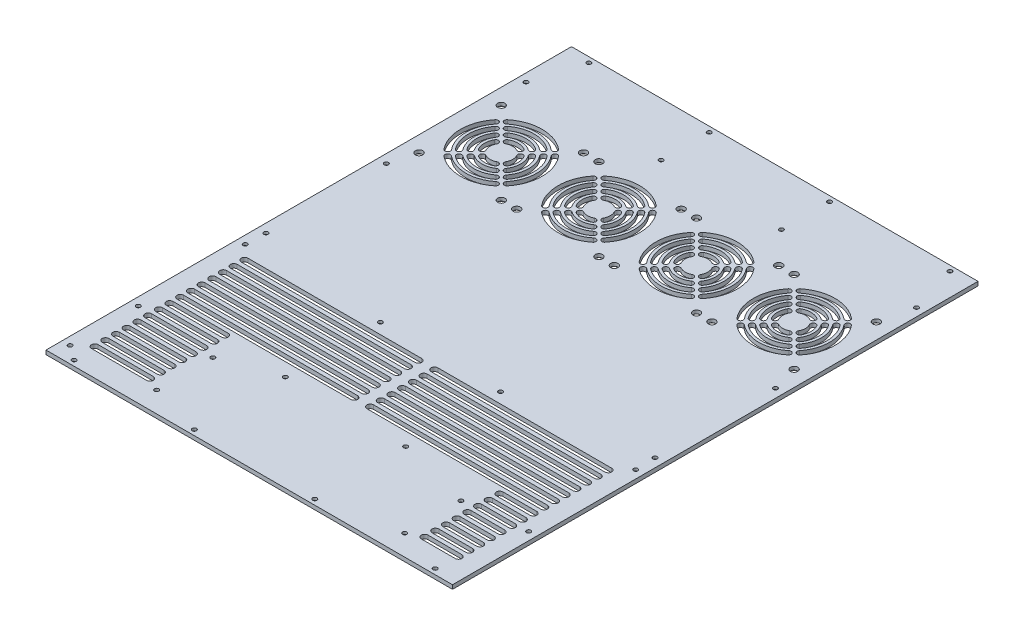
from build123d import *

# Parameters (mm, degrees)
SKIZZE1_W                       = 304
SKIZZE1_H                       = 393
AUFSATZ_LINEAR_AUSTRAGEN1_DEPTH = 3
SKIZZE3_R                       = 1.6
PCB_SCREWS_DEPTH                = 293.596992466
SKIZZE8_R                       = 1.6
MAIN_SCREWS_DEPTH               = 293.596992466
SKIZZE12_R                      = 1.6
SCHNITT_LINEAR_AUSTRAGEN5_DEPTH = 293.596992466
SCHNITT_LINEAR_AUSTRAGEN4_DEPTH = 293.596992466
SKIZZE9_R                       = 2.75
SCHNITT_LINEAR_AUSTRAGEN2_DEPTH = 10
FASE2_SIZE                      = 0.5
KREISMUSTER1_COUNT              = 4
FASE2_OF_KREISMUSTER1_SIZE      = 0.5
LINEARES_MUSTER1_DEPTH          = 3
SCHNITT_LINEAR_AUSTRAGEN3_DEPTH = 293.596992466
FASE1_SIZE                      = 1


# Read off the part's stored shape, not the designer's step: Lineares Muster1
with BuildPart() as part:
    # Skizze1 → Aufsatz-Linear austragen1 (new body)
    with BuildSketch(Plane(origin=(0, 0, 0), x_dir=(1, 0, 0), z_dir=(0, 1, 0))):
        with Locations((0, 53.5)):
            Rectangle(SKIZZE1_W, SKIZZE1_H)
    extrude(amount=AUFSATZ_LINEAR_AUSTRAGEN1_DEPTH)

    # Skizze3 → PCB-Screws (cut, through all)
    with BuildSketch(Plane(origin=(0, 3, 0), x_dir=(1, 0, 0), z_dir=(0, 1, 0))):
        with Locations(Location((-146, -131, 0), (0, 0, 270))):
            Circle(SKIZZE3_R)
        with Locations(Location((-146, -80, 0), (0, 0, 270))):
            Circle(SKIZZE3_R)
        with Locations(Location((-146, 0, 0), (0, 0, 270))):
            Circle(SKIZZE3_R)
        with Locations(Location((-45, 0, 0), (0, 0, 270))):
            Circle(SKIZZE3_R)
        with Locations(Location((45, 0, 0), (0, 0, 270))):
            Circle(SKIZZE3_R)
        with Locations(Location((146, 0, 0), (0, 0, 270))):
            Circle(SKIZZE3_R)
        with Locations(Location((146, -80, 0), (0, 0, 270))):
            Circle(SKIZZE3_R)
        with Locations(Location((146, 210, 0), (0, 0, 270))):
            Circle(SKIZZE3_R)
        with Locations(Location((45, 210, 0), (0, 0, 270))):
            Circle(SKIZZE3_R)
        with Locations(Location((-45, 210, 0), (0, 0, 270))):
            Circle(SKIZZE3_R)
        with Locations(Location((-146, 210, 0), (0, 0, 270))):
            Circle(SKIZZE3_R)
        with Locations(Location((-45, -71, 0), (0, 0, 270))):
            Circle(SKIZZE3_R)
        with Locations(Location((45, -71, 0), (0, 0, 270))):
            Circle(SKIZZE3_R)
    extrude(amount=-PCB_SCREWS_DEPTH, mode=Mode.SUBTRACT)

    # Skizze8 → Main-Screws (cut, through all)
    with BuildSketch(Plane(origin=(0, 3, 0), x_dir=(1, 0, 0), z_dir=(0, 1, 0))):
        with Locations(Location((-135, 246, 0), (0, 0, 270))):
            Circle(SKIZZE8_R)
        with Locations(Location((-45, 246, 0), (0, 0, 270))):
            Circle(SKIZZE8_R)
        with Locations(Location((45, 246, 0), (0, 0, 270))):
            Circle(SKIZZE8_R)
        with Locations(Location((135, 246, 0), (0, 0, 270))):
            Circle(SKIZZE8_R)
        with Locations(Location((-135, -139, 0), (0, 0, 270))):
            Circle(SKIZZE8_R)
        with Locations(Location((-45, -139, 0), (0, 0, 270))):
            Circle(SKIZZE8_R)
        with Locations(Location((45, -139, 0), (0, 0, 270))):
            Circle(SKIZZE8_R)
        with Locations(Location((135, -139, 0), (0, 0, 270))):
            Circle(SKIZZE8_R)
    extrude(amount=-MAIN_SCREWS_DEPTH, mode=Mode.SUBTRACT)

    # Skizze12 → Schnitt-Linear austragen5 (cut, through all)
    with BuildSketch(Plane(origin=(0, 3, 0), x_dir=(1, 0, 0), z_dir=(0, 1, 0))):
        with Locations(Location((-145.5, 15, 0), (0, 0, 270))):
            Circle(SKIZZE12_R)
        with Locations(Location((145.5, 105, 0), (0, 0, 270))):
            Circle(SKIZZE12_R)
        with Locations(Location((-145.5, 105, 0), (0, 0, 90))):
            Circle(SKIZZE12_R)
        with Locations(Location((145.5, 15, 0), (0, 0, 270))):
            Circle(SKIZZE12_R)
    extrude(amount=-SCHNITT_LINEAR_AUSTRAGEN5_DEPTH, mode=Mode.SUBTRACT)

    # Skizze11 → Schnitt-Linear austragen4 (cut, through all)
    with BuildSketch(Plane(origin=(0, 3, 0), x_dir=(1, 0, 0), z_dir=(0, 1, 0))):
        with BuildLine():
            ThreePointArc((-83.15, -127.5), (-83.61862915, -126.36862915), (-84.75, -125.9))
            Line((-84.75, -125.9), (-84.75, -127.5))
            Line((-84.75, -127.5), (-83.15, -127.5))
        make_face()
        with BuildLine():
            Line((-84.75, -127.5), (-84.75, -125.9))
            ThreePointArc((-84.75, -125.9), (-85.88137085, -128.63137085), (-83.15, -127.5))
            Line((-83.15, -127.5), (-84.75, -127.5))
        make_face()
        with BuildLine():
            Line((-84.75, -87.1), (-84.75, -85.5))
            Line((-84.75, -85.5), (-83.15, -85.5))
            ThreePointArc((-83.15, -85.5), (-85.88137085, -84.36862915), (-84.75, -87.1))
        make_face()
        with BuildLine():
            Line((-83.15, -85.5), (-84.75, -85.5))
            Line((-84.75, -85.5), (-84.75, -87.1))
            ThreePointArc((-84.75, -87.1), (-83.61862915, -86.63137085), (-83.15, -85.5))
        make_face()
        with BuildLine():
            ThreePointArc((102.35, -127.5), (101.88137085, -126.36862915), (100.75, -125.9))
            Line((100.75, -125.9), (100.75, -127.5))
            Line((100.75, -127.5), (99.15, -127.5))
            ThreePointArc((99.15, -127.5), (100.75, -129.1), (102.35, -127.5))
        make_face()
        with BuildLine():
            Line((100.75, -127.5), (100.75, -125.9))
            ThreePointArc((100.75, -125.9), (99.61862915, -126.36862915), (99.15, -127.5))
            Line((99.15, -127.5), (100.75, -127.5))
        make_face()
        with BuildLine():
            ThreePointArc((102.35, -85.5), (100.75, -83.9), (99.15, -85.5))
            Line((99.15, -85.5), (100.75, -85.5))
            Line((100.75, -85.5), (100.75, -87.1))
            ThreePointArc((100.75, -87.1), (101.88137085, -86.63137085), (102.35, -85.5))
        make_face()
        with BuildLine():
            Line((100.75, -85.5), (99.15, -85.5))
            ThreePointArc((99.15, -85.5), (99.61862915, -86.63137085), (100.75, -87.1))
            Line((100.75, -87.1), (100.75, -85.5))
        make_face()
    extrude(amount=-SCHNITT_LINEAR_AUSTRAGEN4_DEPTH, mode=Mode.SUBTRACT)

    # Skizze9 → Schnitt-Linear austragen2 (cut)
    with BuildSketch(Plane(origin=(0, 3, 0), x_dir=(1, 0, 0), z_dir=(0, 1, 0))):
        with BuildLine():
            ThreePointArc((-130.106682822, 171.661771306), (-130.404411993, 174.474484825), (-133.217125512, 174.176755654))
            ThreePointArc((-133.217125512, 174.176755654), (-140, 155), (-133.217125512, 135.823244346))
            ThreePointArc((-133.217125512, 135.823244346), (-130.404411993, 135.525515175), (-130.106682822, 138.338228694))
            ThreePointArc((-130.106682822, 138.338228694), (-136, 155), (-130.106682822, 171.661771306))
        make_face()
        with BuildLine():
            ThreePointArc((-125.798917155, 167.433424277), (-126.176064964, 170.236776907), (-128.979417594, 169.859629098))
            ThreePointArc((-128.979417594, 169.859629098), (-134.000128301, 155), (-128.979417594, 140.140370902))
            ThreePointArc((-128.979417594, 140.140370902), (-126.176064964, 139.763223093), (-125.798917155, 142.566575723))
            ThreePointArc((-125.798917155, 142.566575723), (-129.999871699, 155), (-125.798917155, 167.433424277))
        make_face()
        with BuildLine():
            ThreePointArc((-121.446342825, 163.217961615), (-121.960602302, 165.999244986), (-124.741885673, 165.484985509))
            ThreePointArc((-124.741885673, 165.484985509), (-128, 155), (-124.741885673, 144.515014491))
            ThreePointArc((-124.741885673, 144.515014491), (-121.960602302, 144.000755014), (-121.446342825, 146.782038385))
            ThreePointArc((-121.446342825, 146.782038385), (-124, 155), (-121.446342825, 163.217961615))
        make_face()
        with BuildLine():
            ThreePointArc((-116.977122207, 159.042603555), (-117.785244242, 161.753127264), (-120.495767951, 160.945005228))
            ThreePointArc((-120.495767951, 160.945005228), (-122, 155), (-120.495767951, 149.054994772))
            ThreePointArc((-120.495767951, 149.054994772), (-117.785244242, 148.246872736), (-116.977122207, 150.957396445))
            ThreePointArc((-116.977122207, 150.957396445), (-118, 155), (-116.977122207, 159.042603555))
        make_face()
        with Locations(Location((-140.25, 185.75, 0), (0, 0, 270))):
            Circle(SKIZZE9_R)
    schnitt_linear_austragen2 = extrude(amount=-SCHNITT_LINEAR_AUSTRAGEN2_DEPTH, mode=Mode.SUBTRACT)

    # Fase2
    fase2_edges = [part.edges().sort_by_distance(p)[0] for p in [
        (-140.25, 0, -188.5),
    ]]
    chamfer(fase2_edges, length=FASE2_SIZE)

    # Kreismuster1: Schnitt-Linear austragen2 ×4 about axis
    kreismuster1_axis = Axis((-109.5, 0, -155), (0, 1, 0))
    for i in range(1, KREISMUSTER1_COUNT):
        add(schnitt_linear_austragen2.rotate(kreismuster1_axis, i * 360 / KREISMUSTER1_COUNT), mode=Mode.SUBTRACT)

    # Fase2 of Kreismuster1
    fase2_of_kreismuster1_edges = [part.edges().sort_by_distance(p)[0] for p in [
        (-143, 0, -124.25),
        (-78.75, 0, -121.5),
        (-76, 0, -185.75),
    ]]
    chamfer(fase2_of_kreismuster1_edges, length=FASE2_OF_KREISMUSTER1_SIZE)

    # Lineares Muster1 outline → Lineares Muster1 (cut)
    with BuildSketch(Plane(origin=(0, 0, 0), x_dir=(1, 0, 0), z_dir=(0, 1, 0))):
        with BuildLine():
            ThreePointArc((-24.066575723, 171.298917155), (-21.263223093, 171.676064964), (-21.640370902, 174.479417594))
            ThreePointArc((-21.640370902, 174.479417594), (-36.5, 179.500128301), (-51.359629098, 174.479417594))
            ThreePointArc((-51.359629098, 174.479417594), (-51.736776907, 171.676064964), (-48.933424277, 171.298917155))
            ThreePointArc((-48.933424277, 171.298917155), (-36.5, 175.499871699), (-24.066575723, 171.298917155))
        make_face()
        with BuildLine():
            ThreePointArc((-48.933424277, 138.701082845), (-51.736776907, 138.323935036), (-51.359629098, 135.520582406))
            ThreePointArc((-51.359629098, 135.520582406), (-36.5, 130.499871699), (-21.640370902, 135.520582406))
            ThreePointArc((-21.640370902, 135.520582406), (-21.263223093, 138.323935036), (-24.066575723, 138.701082845))
            ThreePointArc((-24.066575723, 138.701082845), (-36.5, 134.500128301), (-48.933424277, 138.701082845))
        make_face()
        with BuildLine():
            ThreePointArc((-52.798917155, 167.433424277), (-53.176064964, 170.236776907), (-55.979417594, 169.859629098))
            ThreePointArc((-55.979417594, 169.859629098), (-61.000128301, 155), (-55.979417594, 140.140370902))
            ThreePointArc((-55.979417594, 140.140370902), (-53.176064964, 139.763223093), (-52.798917155, 142.566575723))
            ThreePointArc((-52.798917155, 142.566575723), (-56.999871699, 155), (-52.798917155, 167.433424277))
        make_face()
        with BuildLine():
            ThreePointArc((-20.201082845, 142.566575723), (-19.823935036, 139.763223093), (-17.020582406, 140.140370902))
            ThreePointArc((-17.020582406, 140.140370902), (-11.999871699, 155), (-17.020582406, 169.859629098))
            ThreePointArc((-17.020582406, 169.859629098), (-19.823935036, 170.236776907), (-20.201082845, 167.433424277))
            ThreePointArc((-20.201082845, 167.433424277), (-16.000128301, 155), (-20.201082845, 142.566575723))
        make_face()
        with BuildLine():
            ThreePointArc((-28.282038385, 166.946342825), (-25.500755014, 167.460602302), (-26.015014491, 170.241885673))
            ThreePointArc((-26.015014491, 170.241885673), (-36.5, 173.5), (-46.984985509, 170.241885673))
            ThreePointArc((-46.984985509, 170.241885673), (-47.499244986, 167.460602302), (-44.717961615, 166.946342825))
            ThreePointArc((-44.717961615, 166.946342825), (-36.5, 169.5), (-28.282038385, 166.946342825))
        make_face()
        with BuildLine():
            ThreePointArc((-44.717961615, 143.053657175), (-47.499244986, 142.539397698), (-46.984985509, 139.758114327))
            ThreePointArc((-46.984985509, 139.758114327), (-36.5, 136.5), (-26.015014491, 139.758114327))
            ThreePointArc((-26.015014491, 139.758114327), (-25.500755014, 142.539397698), (-28.282038385, 143.053657175))
            ThreePointArc((-28.282038385, 143.053657175), (-36.5, 140.5), (-44.717961615, 143.053657175))
        make_face()
        with BuildLine():
            ThreePointArc((-48.446342825, 163.217961615), (-48.960602302, 165.999244986), (-51.741885673, 165.484985509))
            ThreePointArc((-51.741885673, 165.484985509), (-55, 155), (-51.741885673, 144.515014491))
            ThreePointArc((-51.741885673, 144.515014491), (-48.960602302, 144.000755014), (-48.446342825, 146.782038385))
            ThreePointArc((-48.446342825, 146.782038385), (-51, 155), (-48.446342825, 163.217961615))
        make_face()
        with BuildLine():
            ThreePointArc((-24.553657175, 146.782038385), (-24.039397698, 144.000755014), (-21.258114327, 144.515014491))
            ThreePointArc((-21.258114327, 144.515014491), (-18, 155), (-21.258114327, 165.484985509))
            ThreePointArc((-21.258114327, 165.484985509), (-24.039397698, 165.999244986), (-24.553657175, 163.217961615))
            ThreePointArc((-24.553657175, 163.217961615), (-22, 155), (-24.553657175, 146.782038385))
        make_face()
        with BuildLine():
            ThreePointArc((-19.838228694, 175.606682822), (-17.025515175, 175.904411993), (-17.323244346, 178.717125512))
            ThreePointArc((-17.323244346, 178.717125512), (-36.5, 185.5), (-55.676755654, 178.717125512))
            ThreePointArc((-55.676755654, 178.717125512), (-55.974484825, 175.904411993), (-53.161771306, 175.606682822))
            ThreePointArc((-53.161771306, 175.606682822), (-36.5, 181.5), (-19.838228694, 175.606682822))
        make_face()
        with BuildLine():
            ThreePointArc((-57.106682822, 171.661771306), (-57.404411993, 174.474484825), (-60.217125512, 174.176755654))
            ThreePointArc((-60.217125512, 174.176755654), (-67, 155), (-60.217125512, 135.823244346))
            ThreePointArc((-60.217125512, 135.823244346), (-57.404411993, 135.525515175), (-57.106682822, 138.338228694))
            ThreePointArc((-57.106682822, 138.338228694), (-63, 155), (-57.106682822, 171.661771306))
        make_face()
        with BuildLine():
            ThreePointArc((-15.893317178, 138.338228694), (-15.595588007, 135.525515175), (-12.782874488, 135.823244346))
            ThreePointArc((-12.782874488, 135.823244346), (-6, 155), (-12.782874488, 174.176755654))
            ThreePointArc((-12.782874488, 174.176755654), (-15.595588007, 174.474484825), (-15.893317178, 171.661771306))
            ThreePointArc((-15.893317178, 171.661771306), (-10, 155), (-15.893317178, 138.338228694))
        make_face()
        with BuildLine():
            ThreePointArc((-53.161771306, 134.393317178), (-55.974484825, 134.095588007), (-55.676755654, 131.282874488))
            ThreePointArc((-55.676755654, 131.282874488), (-36.5, 124.5), (-17.323244346, 131.282874488))
            ThreePointArc((-17.323244346, 131.282874488), (-17.025515175, 134.095588007), (-19.838228694, 134.393317178))
            ThreePointArc((-19.838228694, 134.393317178), (-36.5, 128.5), (-53.161771306, 134.393317178))
        make_face()
        with BuildLine():
            ThreePointArc((-40.542603555, 147.522877793), (-43.253127264, 146.714755758), (-42.445005228, 144.004232049))
            ThreePointArc((-42.445005228, 144.004232049), (-36.5, 142.5), (-30.554994772, 144.004232049))
            ThreePointArc((-30.554994772, 144.004232049), (-29.746872736, 146.714755758), (-32.457396445, 147.522877793))
            ThreePointArc((-32.457396445, 147.522877793), (-36.5, 146.5), (-40.542603555, 147.522877793))
        make_face()
        with BuildLine():
            ThreePointArc((-43.977122207, 159.042603555), (-44.785244242, 161.753127264), (-47.495767951, 160.945005228))
            ThreePointArc((-47.495767951, 160.945005228), (-49, 155), (-47.495767951, 149.054994772))
            ThreePointArc((-47.495767951, 149.054994772), (-44.785244242, 148.246872736), (-43.977122207, 150.957396445))
            ThreePointArc((-43.977122207, 150.957396445), (-45, 155), (-43.977122207, 159.042603555))
        make_face()
        with BuildLine():
            ThreePointArc((-32.457396445, 162.477122207), (-29.746872736, 163.285244242), (-30.554994772, 165.995767951))
            ThreePointArc((-30.554994772, 165.995767951), (-36.5, 167.5), (-42.445005228, 165.995767951))
            ThreePointArc((-42.445005228, 165.995767951), (-43.253127264, 163.285244242), (-40.542603555, 162.477122207))
            ThreePointArc((-40.542603555, 162.477122207), (-36.5, 163.5), (-32.457396445, 162.477122207))
        make_face()
        with BuildLine():
            ThreePointArc((-29.022877793, 150.957396445), (-28.214755758, 148.246872736), (-25.504232049, 149.054994772))
            ThreePointArc((-25.504232049, 149.054994772), (-24, 155), (-25.504232049, 160.945005228))
            ThreePointArc((-25.504232049, 160.945005228), (-28.214755758, 161.753127264), (-29.022877793, 159.042603555))
            ThreePointArc((-29.022877793, 159.042603555), (-28, 155), (-29.022877793, 150.957396445))
        make_face()
        with BuildLine():
            ThreePointArc((48.933424277, 171.298917155), (51.736776907, 171.676064964), (51.359629098, 174.479417594))
            ThreePointArc((51.359629098, 174.479417594), (36.5, 179.500128301), (21.640370902, 174.479417594))
            ThreePointArc((21.640370902, 174.479417594), (21.263223093, 171.676064964), (24.066575723, 171.298917155))
            ThreePointArc((24.066575723, 171.298917155), (36.5, 175.499871699), (48.933424277, 171.298917155))
        make_face()
        with BuildLine():
            ThreePointArc((24.066575723, 138.701082845), (21.263223093, 138.323935036), (21.640370902, 135.520582406))
            ThreePointArc((21.640370902, 135.520582406), (36.5, 130.499871699), (51.359629098, 135.520582406))
            ThreePointArc((51.359629098, 135.520582406), (51.736776907, 138.323935036), (48.933424277, 138.701082845))
            ThreePointArc((48.933424277, 138.701082845), (36.5, 134.500128301), (24.066575723, 138.701082845))
        make_face()
        with BuildLine():
            ThreePointArc((20.201082845, 167.433424277), (19.823935036, 170.236776907), (17.020582406, 169.859629098))
            ThreePointArc((17.020582406, 169.859629098), (11.999871699, 155), (17.020582406, 140.140370902))
            ThreePointArc((17.020582406, 140.140370902), (19.823935036, 139.763223093), (20.201082845, 142.566575723))
            ThreePointArc((20.201082845, 142.566575723), (16.000128301, 155), (20.201082845, 167.433424277))
        make_face()
        with BuildLine():
            ThreePointArc((52.798917155, 142.566575723), (53.176064964, 139.763223093), (55.979417594, 140.140370902))
            ThreePointArc((55.979417594, 140.140370902), (61.000128301, 155), (55.979417594, 169.859629098))
            ThreePointArc((55.979417594, 169.859629098), (53.176064964, 170.236776907), (52.798917155, 167.433424277))
            ThreePointArc((52.798917155, 167.433424277), (56.999871699, 155), (52.798917155, 142.566575723))
        make_face()
        with BuildLine():
            ThreePointArc((44.717961615, 166.946342825), (47.499244986, 167.460602302), (46.984985509, 170.241885673))
            ThreePointArc((46.984985509, 170.241885673), (36.5, 173.5), (26.015014491, 170.241885673))
            ThreePointArc((26.015014491, 170.241885673), (25.500755014, 167.460602302), (28.282038385, 166.946342825))
            ThreePointArc((28.282038385, 166.946342825), (36.5, 169.5), (44.717961615, 166.946342825))
        make_face()
        with BuildLine():
            ThreePointArc((28.282038385, 143.053657175), (25.500755014, 142.539397698), (26.015014491, 139.758114327))
            ThreePointArc((26.015014491, 139.758114327), (36.5, 136.5), (46.984985509, 139.758114327))
            ThreePointArc((46.984985509, 139.758114327), (47.499244986, 142.539397698), (44.717961615, 143.053657175))
            ThreePointArc((44.717961615, 143.053657175), (36.5, 140.5), (28.282038385, 143.053657175))
        make_face()
        with BuildLine():
            ThreePointArc((24.553657175, 163.217961615), (24.039397698, 165.999244986), (21.258114327, 165.484985509))
            ThreePointArc((21.258114327, 165.484985509), (18, 155), (21.258114327, 144.515014491))
            ThreePointArc((21.258114327, 144.515014491), (24.039397698, 144.000755014), (24.553657175, 146.782038385))
            ThreePointArc((24.553657175, 146.782038385), (22, 155), (24.553657175, 163.217961615))
        make_face()
        with BuildLine():
            ThreePointArc((48.446342825, 146.782038385), (48.960602302, 144.000755014), (51.741885673, 144.515014491))
            ThreePointArc((51.741885673, 144.515014491), (55, 155), (51.741885673, 165.484985509))
            ThreePointArc((51.741885673, 165.484985509), (48.960602302, 165.999244986), (48.446342825, 163.217961615))
            ThreePointArc((48.446342825, 163.217961615), (51, 155), (48.446342825, 146.782038385))
        make_face()
        with BuildLine():
            ThreePointArc((53.161771306, 175.606682822), (55.974484825, 175.904411993), (55.676755654, 178.717125512))
            ThreePointArc((55.676755654, 178.717125512), (36.5, 185.5), (17.323244346, 178.717125512))
            ThreePointArc((17.323244346, 178.717125512), (17.025515175, 175.904411993), (19.838228694, 175.606682822))
            ThreePointArc((19.838228694, 175.606682822), (36.5, 181.5), (53.161771306, 175.606682822))
        make_face()
        with BuildLine():
            ThreePointArc((15.893317178, 171.661771306), (15.595588007, 174.474484825), (12.782874488, 174.176755654))
            ThreePointArc((12.782874488, 174.176755654), (6, 155), (12.782874488, 135.823244346))
            ThreePointArc((12.782874488, 135.823244346), (15.595588007, 135.525515175), (15.893317178, 138.338228694))
            ThreePointArc((15.893317178, 138.338228694), (10, 155), (15.893317178, 171.661771306))
        make_face()
        with BuildLine():
            ThreePointArc((57.106682822, 138.338228694), (57.404411993, 135.525515175), (60.217125512, 135.823244346))
            ThreePointArc((60.217125512, 135.823244346), (67, 155), (60.217125512, 174.176755654))
            ThreePointArc((60.217125512, 174.176755654), (57.404411993, 174.474484825), (57.106682822, 171.661771306))
            ThreePointArc((57.106682822, 171.661771306), (63, 155), (57.106682822, 138.338228694))
        make_face()
        with BuildLine():
            ThreePointArc((19.838228694, 134.393317178), (17.025515175, 134.095588007), (17.323244346, 131.282874488))
            ThreePointArc((17.323244346, 131.282874488), (36.5, 124.5), (55.676755654, 131.282874488))
            ThreePointArc((55.676755654, 131.282874488), (55.974484825, 134.095588007), (53.161771306, 134.393317178))
            ThreePointArc((53.161771306, 134.393317178), (36.5, 128.5), (19.838228694, 134.393317178))
        make_face()
        with BuildLine():
            ThreePointArc((32.457396445, 147.522877793), (29.746872736, 146.714755758), (30.554994772, 144.004232049))
            ThreePointArc((30.554994772, 144.004232049), (36.5, 142.5), (42.445005228, 144.004232049))
            ThreePointArc((42.445005228, 144.004232049), (43.253127264, 146.714755758), (40.542603555, 147.522877793))
            ThreePointArc((40.542603555, 147.522877793), (36.5, 146.5), (32.457396445, 147.522877793))
        make_face()
        with BuildLine():
            ThreePointArc((29.022877793, 159.042603555), (28.214755758, 161.753127264), (25.504232049, 160.945005228))
            ThreePointArc((25.504232049, 160.945005228), (24, 155), (25.504232049, 149.054994772))
            ThreePointArc((25.504232049, 149.054994772), (28.214755758, 148.246872736), (29.022877793, 150.957396445))
            ThreePointArc((29.022877793, 150.957396445), (28, 155), (29.022877793, 159.042603555))
        make_face()
        with BuildLine():
            ThreePointArc((40.542603555, 162.477122207), (43.253127264, 163.285244242), (42.445005228, 165.995767951))
            ThreePointArc((42.445005228, 165.995767951), (36.5, 167.5), (30.554994772, 165.995767951))
            ThreePointArc((30.554994772, 165.995767951), (29.746872736, 163.285244242), (32.457396445, 162.477122207))
            ThreePointArc((32.457396445, 162.477122207), (36.5, 163.5), (40.542603555, 162.477122207))
        make_face()
        with BuildLine():
            ThreePointArc((43.977122207, 150.957396445), (44.785244242, 148.246872736), (47.495767951, 149.054994772))
            ThreePointArc((47.495767951, 149.054994772), (49, 155), (47.495767951, 160.945005228))
            ThreePointArc((47.495767951, 160.945005228), (44.785244242, 161.753127264), (43.977122207, 159.042603555))
            ThreePointArc((43.977122207, 159.042603555), (45, 155), (43.977122207, 150.957396445))
        make_face()
        with BuildLine():
            ThreePointArc((121.933424277, 171.298917155), (124.736776907, 171.676064964), (124.359629098, 174.479417594))
            ThreePointArc((124.359629098, 174.479417594), (109.5, 179.500128301), (94.640370902, 174.479417594))
            ThreePointArc((94.640370902, 174.479417594), (94.263223093, 171.676064964), (97.066575723, 171.298917155))
            ThreePointArc((97.066575723, 171.298917155), (109.5, 175.499871699), (121.933424277, 171.298917155))
        make_face()
        with BuildLine():
            ThreePointArc((97.066575723, 138.701082845), (94.263223093, 138.323935036), (94.640370902, 135.520582406))
            ThreePointArc((94.640370902, 135.520582406), (109.5, 130.499871699), (124.359629098, 135.520582406))
            ThreePointArc((124.359629098, 135.520582406), (124.736776907, 138.323935036), (121.933424277, 138.701082845))
            ThreePointArc((121.933424277, 138.701082845), (109.5, 134.500128301), (97.066575723, 138.701082845))
        make_face()
        with BuildLine():
            ThreePointArc((93.201082845, 167.433424277), (92.823935036, 170.236776907), (90.020582406, 169.859629098))
            ThreePointArc((90.020582406, 169.859629098), (84.999871699, 155), (90.020582406, 140.140370902))
            ThreePointArc((90.020582406, 140.140370902), (92.823935036, 139.763223093), (93.201082845, 142.566575723))
            ThreePointArc((93.201082845, 142.566575723), (89.000128301, 155), (93.201082845, 167.433424277))
        make_face()
        with BuildLine():
            ThreePointArc((125.798917155, 142.566575723), (126.176064964, 139.763223093), (128.979417594, 140.140370902))
            ThreePointArc((128.979417594, 140.140370902), (134.000128301, 155), (128.979417594, 169.859629098))
            ThreePointArc((128.979417594, 169.859629098), (126.176064964, 170.236776907), (125.798917155, 167.433424277))
            ThreePointArc((125.798917155, 167.433424277), (129.999871699, 155), (125.798917155, 142.566575723))
        make_face()
        with BuildLine():
            ThreePointArc((117.717961615, 166.946342825), (120.499244986, 167.460602302), (119.984985509, 170.241885673))
            ThreePointArc((119.984985509, 170.241885673), (109.5, 173.5), (99.015014491, 170.241885673))
            ThreePointArc((99.015014491, 170.241885673), (98.500755014, 167.460602302), (101.282038385, 166.946342825))
            ThreePointArc((101.282038385, 166.946342825), (109.5, 169.5), (117.717961615, 166.946342825))
        make_face()
        with BuildLine():
            ThreePointArc((101.282038385, 143.053657175), (98.500755014, 142.539397698), (99.015014491, 139.758114327))
            ThreePointArc((99.015014491, 139.758114327), (109.5, 136.5), (119.984985509, 139.758114327))
            ThreePointArc((119.984985509, 139.758114327), (120.499244986, 142.539397698), (117.717961615, 143.053657175))
            ThreePointArc((117.717961615, 143.053657175), (109.5, 140.5), (101.282038385, 143.053657175))
        make_face()
        with BuildLine():
            ThreePointArc((97.553657175, 163.217961615), (97.039397698, 165.999244986), (94.258114327, 165.484985509))
            ThreePointArc((94.258114327, 165.484985509), (91, 155), (94.258114327, 144.515014491))
            ThreePointArc((94.258114327, 144.515014491), (97.039397698, 144.000755014), (97.553657175, 146.782038385))
            ThreePointArc((97.553657175, 146.782038385), (95, 155), (97.553657175, 163.217961615))
        make_face()
        with BuildLine():
            ThreePointArc((121.446342825, 146.782038385), (121.960602302, 144.000755014), (124.741885673, 144.515014491))
            ThreePointArc((124.741885673, 144.515014491), (128, 155), (124.741885673, 165.484985509))
            ThreePointArc((124.741885673, 165.484985509), (121.960602302, 165.999244986), (121.446342825, 163.217961615))
            ThreePointArc((121.446342825, 163.217961615), (124, 155), (121.446342825, 146.782038385))
        make_face()
        with BuildLine():
            ThreePointArc((126.161771306, 175.606682822), (128.974484825, 175.904411993), (128.676755654, 178.717125512))
            ThreePointArc((128.676755654, 178.717125512), (109.5, 185.5), (90.323244346, 178.717125512))
            ThreePointArc((90.323244346, 178.717125512), (90.025515175, 175.904411993), (92.838228694, 175.606682822))
            ThreePointArc((92.838228694, 175.606682822), (109.5, 181.5), (126.161771306, 175.606682822))
        make_face()
        with BuildLine():
            ThreePointArc((88.893317178, 171.661771306), (88.595588007, 174.474484825), (85.782874488, 174.176755654))
            ThreePointArc((85.782874488, 174.176755654), (79, 155), (85.782874488, 135.823244346))
            ThreePointArc((85.782874488, 135.823244346), (88.595588007, 135.525515175), (88.893317178, 138.338228694))
            ThreePointArc((88.893317178, 138.338228694), (83, 155), (88.893317178, 171.661771306))
        make_face()
        with BuildLine():
            ThreePointArc((130.106682822, 138.338228694), (130.404411993, 135.525515175), (133.217125512, 135.823244346))
            ThreePointArc((133.217125512, 135.823244346), (140, 155), (133.217125512, 174.176755654))
            ThreePointArc((133.217125512, 174.176755654), (130.404411993, 174.474484825), (130.106682822, 171.661771306))
            ThreePointArc((130.106682822, 171.661771306), (136, 155), (130.106682822, 138.338228694))
        make_face()
        with BuildLine():
            ThreePointArc((92.838228694, 134.393317178), (90.025515175, 134.095588007), (90.323244346, 131.282874488))
            ThreePointArc((90.323244346, 131.282874488), (109.5, 124.5), (128.676755654, 131.282874488))
            ThreePointArc((128.676755654, 131.282874488), (128.974484825, 134.095588007), (126.161771306, 134.393317178))
            ThreePointArc((126.161771306, 134.393317178), (109.5, 128.5), (92.838228694, 134.393317178))
        make_face()
        with BuildLine():
            ThreePointArc((105.457396445, 147.522877793), (102.746872736, 146.714755758), (103.554994772, 144.004232049))
            ThreePointArc((103.554994772, 144.004232049), (109.5, 142.5), (115.445005228, 144.004232049))
            ThreePointArc((115.445005228, 144.004232049), (116.253127264, 146.714755758), (113.542603555, 147.522877793))
            ThreePointArc((113.542603555, 147.522877793), (109.5, 146.5), (105.457396445, 147.522877793))
        make_face()
        with BuildLine():
            ThreePointArc((102.022877793, 159.042603555), (101.214755758, 161.753127264), (98.504232049, 160.945005228))
            ThreePointArc((98.504232049, 160.945005228), (97, 155), (98.504232049, 149.054994772))
            ThreePointArc((98.504232049, 149.054994772), (101.214755758, 148.246872736), (102.022877793, 150.957396445))
            ThreePointArc((102.022877793, 150.957396445), (101, 155), (102.022877793, 159.042603555))
        make_face()
        with BuildLine():
            ThreePointArc((113.542603555, 162.477122207), (116.253127264, 163.285244242), (115.445005228, 165.995767951))
            ThreePointArc((115.445005228, 165.995767951), (109.5, 167.5), (103.554994772, 165.995767951))
            ThreePointArc((103.554994772, 165.995767951), (102.746872736, 163.285244242), (105.457396445, 162.477122207))
            ThreePointArc((105.457396445, 162.477122207), (109.5, 163.5), (113.542603555, 162.477122207))
        make_face()
        with BuildLine():
            ThreePointArc((116.977122207, 150.957396445), (117.785244242, 148.246872736), (120.495767951, 149.054994772))
            ThreePointArc((120.495767951, 149.054994772), (122, 155), (120.495767951, 160.945005228))
            ThreePointArc((120.495767951, 160.945005228), (117.785244242, 161.753127264), (116.977122207, 159.042603555))
            ThreePointArc((116.977122207, 159.042603555), (118, 155), (116.977122207, 150.957396445))
        make_face()
    extrude(amount=LINEARES_MUSTER1_DEPTH, mode=Mode.SUBTRACT)

    # Lineares Muster1 2 outline → Lineares Muster1 2 (revolve, cut)
    with BuildSketch(Plane(origin=(-67.25, 0, -185.75), x_dir=(1, 0, 0), z_dir=(0, 0, 1))):
        Polygon((0, 0), (3.25, 0), (2.75, 0.5), (2.75, 3), (0, 3), align=None)
    revolve(axis=Axis((-67.25, 0, -185.75), (0, 1, 0)), mode=Mode.SUBTRACT)

    # Lineares Muster1 3 outline → Lineares Muster1 3 (revolve, cut)
    with BuildSketch(Plane(origin=(-67.25, 0, -124.25), x_dir=(1, 0, 0), z_dir=(0, 0, 1))):
        Polygon((0, 0), (3.25, 0), (2.75, 0.5), (2.75, 3), (0, 3), align=None)
    revolve(axis=Axis((-67.25, 0, -124.25), (0, 1, 0)), mode=Mode.SUBTRACT)

    # Lineares Muster1 4 outline → Lineares Muster1 4 (revolve, cut)
    with BuildSketch(Plane(origin=(-5.75, 0, -185.75), x_dir=(1, 0, 0), z_dir=(0, 0, 1))):
        Polygon((0, 0), (3.25, 0), (2.75, 0.5), (2.75, 3), (0, 3), align=None)
    revolve(axis=Axis((-5.75, 0, -185.75), (0, 1, 0)), mode=Mode.SUBTRACT)

    # Lineares Muster1 5 outline → Lineares Muster1 5 (revolve, cut)
    with BuildSketch(Plane(origin=(-5.75, 0, -124.25), x_dir=(1, 0, 0), z_dir=(0, 0, 1))):
        Polygon((0, 0), (3.25, 0), (2.75, 0.5), (2.75, 3), (0, 3), align=None)
    revolve(axis=Axis((-5.75, 0, -124.25), (0, 1, 0)), mode=Mode.SUBTRACT)

    # Lineares Muster1 6 outline → Lineares Muster1 6 (revolve, cut)
    with BuildSketch(Plane(origin=(5.75, 0, -185.75), x_dir=(1, 0, 0), z_dir=(0, 0, 1))):
        Polygon((0, 0), (3.25, 0), (2.75, 0.5), (2.75, 3), (0, 3), align=None)
    revolve(axis=Axis((5.75, 0, -185.75), (0, 1, 0)), mode=Mode.SUBTRACT)

    # Lineares Muster1 7 outline → Lineares Muster1 7 (revolve, cut)
    with BuildSketch(Plane(origin=(5.75, 0, -124.25), x_dir=(1, 0, 0), z_dir=(0, 0, 1))):
        Polygon((0, 0), (3.25, 0), (2.75, 0.5), (2.75, 3), (0, 3), align=None)
    revolve(axis=Axis((5.75, 0, -124.25), (0, 1, 0)), mode=Mode.SUBTRACT)

    # Lineares Muster1 8 outline → Lineares Muster1 8 (revolve, cut)
    with BuildSketch(Plane(origin=(67.25, 0, -185.75), x_dir=(1, 0, 0), z_dir=(0, 0, 1))):
        Polygon((0, 0), (3.25, 0), (2.75, 0.5), (2.75, 3), (0, 3), align=None)
    revolve(axis=Axis((67.25, 0, -185.75), (0, 1, 0)), mode=Mode.SUBTRACT)

    # Lineares Muster1 9 outline → Lineares Muster1 9 (revolve, cut)
    with BuildSketch(Plane(origin=(67.25, 0, -124.25), x_dir=(1, 0, 0), z_dir=(0, 0, 1))):
        Polygon((0, 0), (3.25, 0), (2.75, 0.5), (2.75, 3), (0, 3), align=None)
    revolve(axis=Axis((67.25, 0, -124.25), (0, 1, 0)), mode=Mode.SUBTRACT)

    # Lineares Muster1 10 outline → Lineares Muster1 10 (revolve, cut)
    with BuildSketch(Plane(origin=(78.75, 0, -185.75), x_dir=(1, 0, 0), z_dir=(0, 0, 1))):
        Polygon((0, 0), (3.25, 0), (2.75, 0.5), (2.75, 3), (0, 3), align=None)
    revolve(axis=Axis((78.75, 0, -185.75), (0, 1, 0)), mode=Mode.SUBTRACT)

    # Lineares Muster1 11 outline → Lineares Muster1 11 (revolve, cut)
    with BuildSketch(Plane(origin=(78.75, 0, -124.25), x_dir=(1, 0, 0), z_dir=(0, 0, 1))):
        Polygon((0, 0), (3.25, 0), (2.75, 0.5), (2.75, 3), (0, 3), align=None)
    revolve(axis=Axis((78.75, 0, -124.25), (0, 1, 0)), mode=Mode.SUBTRACT)

    # Lineares Muster1 12 outline → Lineares Muster1 12 (revolve, cut)
    with BuildSketch(Plane(origin=(140.25, 0, -185.75), x_dir=(1, 0, 0), z_dir=(0, 0, 1))):
        Polygon((0, 0), (3.25, 0), (2.75, 0.5), (2.75, 3), (0, 3), align=None)
    revolve(axis=Axis((140.25, 0, -185.75), (0, 1, 0)), mode=Mode.SUBTRACT)

    # Lineares Muster1 13 outline → Lineares Muster1 13 (revolve, cut)
    with BuildSketch(Plane(origin=(140.25, 0, -124.25), x_dir=(1, 0, 0), z_dir=(0, 0, 1))):
        Polygon((0, 0), (3.25, 0), (2.75, 0.5), (2.75, 3), (0, 3), align=None)
    revolve(axis=Axis((140.25, 0, -124.25), (0, 1, 0)), mode=Mode.SUBTRACT)

    # Skizze10 → Schnitt-Linear austragen3 (cut, through all)
    with BuildSketch(Plane(origin=(0, 3, 0), x_dir=(1, 0, 0), z_dir=(0, 1, 0))):
        with BuildLine():
            ThreePointArc((-6, -13), (-3.5, -10.5), (-6, -8))
            Line((-6, -8), (-136, -8))
            ThreePointArc((-136, -8), (-138.5, -10.5), (-136, -13))
            Line((-136, -13), (-6, -13))
        make_face()
        with BuildLine():
            Line((-136, -61), (-6, -61))
            ThreePointArc((-6, -61), (-3.5, -58.5), (-6, -56))
            Line((-6, -56), (-136, -56))
            ThreePointArc((-136, -56), (-138.5, -58.5), (-136, -61))
        make_face()
        with BuildLine():
            ThreePointArc((-6, -21), (-3.5, -18.5), (-6, -16))
            Line((-6, -16), (-136, -16))
            ThreePointArc((-136, -16), (-138.5, -18.5), (-136, -21))
            Line((-136, -21), (-6, -21))
        make_face()
        with BuildLine():
            Line((-136, -53), (-6, -53))
            ThreePointArc((-6, -53), (-3.5, -50.5), (-6, -48))
            Line((-6, -48), (-136, -48))
            ThreePointArc((-136, -48), (-138.5, -50.5), (-136, -53))
        make_face()
        with BuildLine():
            ThreePointArc((-6, -29), (-3.5, -26.5), (-6, -24))
            Line((-6, -24), (-136, -24))
            ThreePointArc((-136, -24), (-138.5, -26.5), (-136, -29))
            Line((-136, -29), (-6, -29))
        make_face()
        with BuildLine():
            Line((-136, -45), (-6, -45))
            ThreePointArc((-6, -45), (-3.5, -42.5), (-6, -40))
            Line((-6, -40), (-136, -40))
            ThreePointArc((-136, -40), (-138.5, -42.5), (-136, -45))
        make_face()
        with BuildLine():
            ThreePointArc((-6, -37), (-3.5, -34.5), (-6, -32))
            Line((-6, -32), (-136, -32))
            ThreePointArc((-136, -32), (-138.5, -34.5), (-136, -37))
            Line((-136, -37), (-6, -37))
        make_face()
        with BuildLine():
            Line((-94.75, -120), (-136, -120))
            ThreePointArc((-136, -120), (-138.5, -122.5), (-136, -125))
            Line((-136, -125), (-94.75, -125))
            ThreePointArc((-94.75, -125), (-92.25, -122.5), (-94.75, -120))
        make_face()
        with BuildLine():
            Line((-94.75, -64), (-136, -64))
            ThreePointArc((-136, -64), (-138.5, -66.5), (-136, -69))
            Line((-136, -69), (-94.75, -69))
            ThreePointArc((-94.75, -69), (-92.25, -66.5), (-94.75, -64))
        make_face()
        with BuildLine():
            Line((-94.75, -72), (-136, -72))
            ThreePointArc((-136, -72), (-138.5, -74.5), (-136, -77))
            Line((-136, -77), (-94.75, -77))
            ThreePointArc((-94.75, -77), (-92.25, -74.5), (-94.75, -72))
        make_face()
        with BuildLine():
            Line((-94.75, -80), (-136, -80))
            ThreePointArc((-136, -80), (-138.5, -82.5), (-136, -85))
            Line((-136, -85), (-94.75, -85))
            ThreePointArc((-94.75, -85), (-92.25, -82.5), (-94.75, -80))
        make_face()
        with BuildLine():
            Line((-94.75, -88), (-136, -88))
            ThreePointArc((-136, -88), (-138.5, -90.5), (-136, -93))
            Line((-136, -93), (-94.75, -93))
            ThreePointArc((-94.75, -93), (-92.25, -90.5), (-94.75, -88))
        make_face()
        with BuildLine():
            Line((-94.75, -96), (-136, -96))
            ThreePointArc((-136, -96), (-138.5, -98.5), (-136, -101))
            Line((-136, -101), (-94.75, -101))
            ThreePointArc((-94.75, -101), (-92.25, -98.5), (-94.75, -96))
        make_face()
        with BuildLine():
            Line((-94.75, -104), (-136, -104))
            ThreePointArc((-136, -104), (-138.5, -106.5), (-136, -109))
            Line((-136, -109), (-94.75, -109))
            ThreePointArc((-94.75, -109), (-92.25, -106.5), (-94.75, -104))
        make_face()
        with BuildLine():
            Line((-94.75, -112), (-136, -112))
            ThreePointArc((-136, -112), (-138.5, -114.5), (-136, -117))
            Line((-136, -117), (-94.75, -117))
            ThreePointArc((-94.75, -117), (-92.25, -114.5), (-94.75, -112))
        make_face()
        with BuildLine():
            ThreePointArc((136, -13), (138.5, -10.5), (136, -8))
            Line((136, -8), (6, -8))
            ThreePointArc((6, -8), (3.5, -10.5), (6, -13))
            Line((6, -13), (136, -13))
        make_face()
        with BuildLine():
            ThreePointArc((136, -21), (138.5, -18.5), (136, -16))
            Line((136, -16), (6, -16))
            ThreePointArc((6, -16), (3.5, -18.5), (6, -21))
            Line((6, -21), (136, -21))
        make_face()
        with BuildLine():
            ThreePointArc((136, -29), (138.5, -26.5), (136, -24))
            Line((136, -24), (6, -24))
            ThreePointArc((6, -24), (3.5, -26.5), (6, -29))
            Line((6, -29), (136, -29))
        make_face()
        with BuildLine():
            ThreePointArc((136, -37), (138.5, -34.5), (136, -32))
            Line((136, -32), (6, -32))
            ThreePointArc((6, -32), (3.5, -34.5), (6, -37))
            Line((6, -37), (136, -37))
        make_face()
        with BuildLine():
            ThreePointArc((136, -45), (138.5, -42.5), (136, -40))
            Line((136, -40), (6, -40))
            ThreePointArc((6, -40), (3.5, -42.5), (6, -45))
            Line((6, -45), (136, -45))
        make_face()
        with BuildLine():
            ThreePointArc((136, -53), (138.5, -50.5), (136, -48))
            Line((136, -48), (6, -48))
            ThreePointArc((6, -48), (3.5, -50.5), (6, -53))
            Line((6, -53), (136, -53))
        make_face()
        with BuildLine():
            ThreePointArc((136, -61), (138.5, -58.5), (136, -56))
            Line((136, -56), (6, -56))
            ThreePointArc((6, -56), (3.5, -58.5), (6, -61))
            Line((6, -61), (136, -61))
        make_face()
        with BuildLine():
            ThreePointArc((136, -69), (138.5, -66.5), (136, -64))
            Line((136, -64), (110.75, -64))
            ThreePointArc((110.75, -64), (108.25, -66.5), (110.75, -69))
            Line((110.75, -69), (136, -69))
        make_face()
        with BuildLine():
            ThreePointArc((136, -77), (138.5, -74.5), (136, -72))
            Line((136, -72), (110.75, -72))
            ThreePointArc((110.75, -72), (108.25, -74.5), (110.75, -77))
            Line((110.75, -77), (136, -77))
        make_face()
        with BuildLine():
            ThreePointArc((136, -85), (138.5, -82.5), (136, -80))
            Line((136, -80), (110.75, -80))
            ThreePointArc((110.75, -80), (108.25, -82.5), (110.75, -85))
            Line((110.75, -85), (136, -85))
        make_face()
        with BuildLine():
            ThreePointArc((136, -93), (138.5, -90.5), (136, -88))
            Line((136, -88), (110.75, -88))
            ThreePointArc((110.75, -88), (108.25, -90.5), (110.75, -93))
            Line((110.75, -93), (136, -93))
        make_face()
        with BuildLine():
            ThreePointArc((136, -101), (138.5, -98.5), (136, -96))
            Line((136, -96), (110.75, -96))
            ThreePointArc((110.75, -96), (108.25, -98.5), (110.75, -101))
            Line((110.75, -101), (136, -101))
        make_face()
        with BuildLine():
            ThreePointArc((136, -109), (138.5, -106.5), (136, -104))
            Line((136, -104), (110.75, -104))
            ThreePointArc((110.75, -104), (108.25, -106.5), (110.75, -109))
            Line((110.75, -109), (136, -109))
        make_face()
        with BuildLine():
            ThreePointArc((136, -117), (138.5, -114.5), (136, -112))
            Line((136, -112), (110.75, -112))
            ThreePointArc((110.75, -112), (108.25, -114.5), (110.75, -117))
            Line((110.75, -117), (136, -117))
        make_face()
        with BuildLine():
            ThreePointArc((136, -125), (138.5, -122.5), (136, -120))
            Line((136, -120), (110.75, -120))
            ThreePointArc((110.75, -120), (108.25, -122.5), (110.75, -125))
            Line((110.75, -125), (136, -125))
        make_face()
    extrude(amount=-SCHNITT_LINEAR_AUSTRAGEN3_DEPTH, mode=Mode.SUBTRACT)

    # Fase1
    fase1_edges = [part.edges().sort_by_distance(p)[0] for p in [
        (145.5, 0, -16.6),
        (-145.5, 0, -103.4),
        (145.5, 0, -106.6),
        (-145.5, 0, -16.6),
        (-84.75, 0, 83.9),
        (100.75, 0, 129.1),
        (102.35, 0, 85.5),
        (-86.35, 0, 127.5),
        (-146, 0, 129.4),
        (45, 0, 69.4),
        (-45, 0, 69.4),
        (-146, 0, -211.6),
        (-45, 0, -211.6),
        (-146, 0, 78.4),
        (-146, 0, -1.6),
        (-45, 0, -1.6),
        (45, 0, -1.6),
        (146, 0, -1.6),
        (146, 0, 78.4),
        (146, 0, -211.6),
        (45, 0, -211.6),
        (-135, 0, 137.4),
        (135, 0, -247.6),
        (45, 0, -247.6),
        (-45, 0, -247.6),
        (-45, 0, 137.4),
        (45, 0, 137.4),
        (135, 0, 137.4),
        (-135, 0, -247.6),
    ]]
    chamfer(fase1_edges, length=FASE1_SIZE)


solid = part.part
